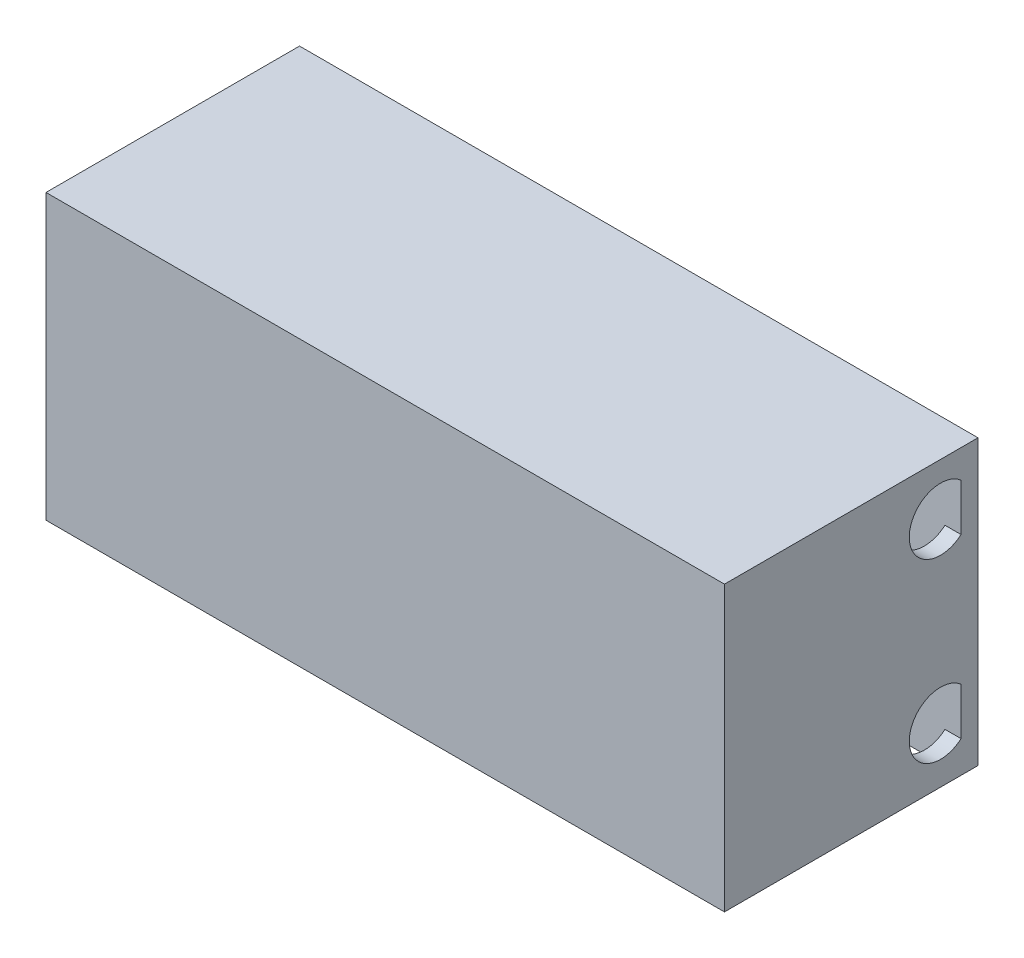
from build123d import *

# Parameters (mm, degrees)
SKETCH1_W            = 76
SKETCH1_H            = 28.4
BOSS_EXTRUDE1_DEPTH  = 1.8
SKETCH2_W            = 76
SKETCH2_H            = 1.8
BOSS_EXTRUDE2_DEPTH  = 30
SKETCH3_W            = 1.8
SKETCH3_H            = 26.6
BOSS_EXTRUDE3_DEPTH  = 30
SKETCH4_W            = 72.4
SKETCH4_H            = 1.2
BOSS_EXTRUDE4_DEPTH  = 1
SKETCH5_W            = 5
SKETCH5_H            = 1.2
BOSS_EXTRUDE5_DEPTH  = 28
SKETCH6_W            = 2.8
SKETCH6_H            = 10
CUT_EXTRUDE1_DEPTH   = 2
SKETCH7_W            = 5
SKETCH7_H            = 1.2
BOSS_EXTRUDE6_DEPTH  = 10
SKETCH8_W            = 8
SKETCH8_H            = 1.2
CUT_EXTRUDE2_DEPTH   = 0.7
SKETCH9_W            = 10
SKETCH9_H            = 0.1
BOSS_EXTRUDE7_DEPTH  = 30
CUT_EXTRUDE3_DEPTH   = 2
SKETCH11_W           = 62.4
SKETCH11_H           = 1.2
BOSS_EXTRUDE8_DEPTH  = 28
SKETCH12_W           = 72.4
SKETCH12_H           = 1.2
BOSS_EXTRUDE9_DEPTH  = 29
SKETCH13_W           = 72.4
SKETCH13_H           = 1.2
BOSS_EXTRUDE10_DEPTH = 1
SKETCH14_W           = 5
SKETCH14_H           = 1.2
SKETCH14_W_2         = 12
BOSS_EXTRUDE11_DEPTH = 5
SKETCH15_W           = 6
SKETCH15_H           = 5
BOSS_EXTRUDE12_DEPTH = 2
SKETCH16_W           = 2.4
SKETCH16_H           = 13.5
CUT_EXTRUDE4_DEPTH   = 2
SKETCH17_W           = 72.4
SKETCH17_H           = 1.8
BOSS_EXTRUDE13_DEPTH = 30
FILLET1_R            = 4
SKETCH19_W           = 2.3
SKETCH19_H           = 1.5
BOSS_EXTRUDE14_DEPTH = 29
FILLET2_R            = 4
FILLET3_R            = 4
FILLET4_R            = 4
SKETCH18_W           = 1
SKETCH18_H           = 10
CUT_EXTRUDE5_DEPTH   = 2


with BuildPart() as part:
    # Sketch1 → Boss-Extrude1 (new body)
    with BuildSketch(Plane(origin=(0, 0, 0), x_dir=(1, 0, 0), z_dir=(0, 1, 0))):
        with Locations((-38, 14.2)):
            Rectangle(SKETCH1_W, SKETCH1_H)
    extrude(amount=BOSS_EXTRUDE1_DEPTH)

    # Sketch2 → Boss-Extrude2 (add)
    with BuildSketch(Plane(origin=(0, 0, 0), x_dir=(-1, 0, 0), z_dir=(0, -1, 0))):
        with Locations((38, 27.5)):
            Rectangle(SKETCH2_W, SKETCH2_H)
    extrude(amount=BOSS_EXTRUDE2_DEPTH)

    # Sketch3 → Boss-Extrude3 (add)
    with BuildSketch(Plane(origin=(0, 0, 0), x_dir=(-1, 0, 0), z_dir=(0, -1, 0))):
        with Locations((75.1, 13.3)):
            Rectangle(SKETCH3_W, SKETCH3_H)
        with Locations((0.9, 13.3)):
            Rectangle(SKETCH3_W, SKETCH3_H)
    extrude(amount=BOSS_EXTRUDE3_DEPTH)

    # Sketch4 → Boss-Extrude4 (add)
    with BuildSketch(Plane(origin=(0, 0, 0), x_dir=(-1, 0, 0), z_dir=(0, -1, 0))):
        with Locations((38, 19.1)):
            Rectangle(SKETCH4_W, SKETCH4_H)
        with Locations((38, 22.1)):
            Rectangle(SKETCH4_W, SKETCH4_H)
    extrude(amount=BOSS_EXTRUDE4_DEPTH)

    # Sketch5 → Boss-Extrude5 (add)
    with BuildSketch(Plane(origin=(0, -1, 0), x_dir=(-1, 0, 0), z_dir=(0, -1, 0))):
        with Locations((4.3, 19.1)):
            Rectangle(SKETCH5_W, SKETCH5_H)
        with Locations((71.7, 19.1)):
            Rectangle(SKETCH5_W, SKETCH5_H)
    extrude(amount=BOSS_EXTRUDE5_DEPTH)

    # Sketch6 → Cut-Extrude1 (cut)
    with BuildSketch(Plane(origin=(-74.2, 0, 0), x_dir=(0, 0, -1), z_dir=(1, 0, 0))):
        with Locations((22.9, -6)):
            Rectangle(SKETCH6_W, SKETCH6_H)
    extrude(amount=-CUT_EXTRUDE1_DEPTH, mode=Mode.SUBTRACT)

    # Sketch7 → Boss-Extrude6 (add)
    with BuildSketch(Plane(origin=(0, 0, 0), x_dir=(-1, 0, 0), z_dir=(0, -1, 0))):
        with Locations((71.7, 24.9)):
            Rectangle(SKETCH7_W, SKETCH7_H)
    extrude(amount=BOSS_EXTRUDE6_DEPTH)

    # Sketch8 → Cut-Extrude2 (cut)
    with BuildSketch(Plane(origin=(0, -1, 0), x_dir=(-1, 0, 0), z_dir=(0, -1, 0))):
        with Locations((5.8, 22.1)):
            Rectangle(SKETCH8_W, SKETCH8_H)
    extrude(amount=-CUT_EXTRUDE2_DEPTH, mode=Mode.SUBTRACT)

    # Sketch9 → Boss-Extrude7 (add)
    with BuildSketch(Plane(origin=(0, 0, 0), x_dir=(-1, 0, 0), z_dir=(0, -1, 0))):
        with Locations((6.8, 26.55)):
            Rectangle(SKETCH9_W, SKETCH9_H)
    extrude(amount=BOSS_EXTRUDE7_DEPTH)

    # Sketch10 → Cut-Extrude3 (cut)
    with BuildSketch(Plane.ZY.offset(1.8)):
        with BuildLine():
            Line((-26.5, -6.638181192), (-26.5, -1.361818808))
            ThreePointArc((-26.5, -1.361818808), (-20.7, -4), (-26.5, -6.638181192))
        make_face()
        with BuildLine():
            Line((-26.5, -21.161818808), (-26.5, -26.438181192))
            ThreePointArc((-26.5, -26.438181192), (-20.7, -23.8), (-26.5, -21.161818808))
        make_face()
    extrude(amount=-CUT_EXTRUDE3_DEPTH, mode=Mode.SUBTRACT)

    # Sketch11 → Boss-Extrude8 (add)
    with BuildSketch(Plane(origin=(0, -1, 0), x_dir=(-1, 0, 0), z_dir=(0, -1, 0))):
        with Locations((38, 19.1)):
            Rectangle(SKETCH11_W, SKETCH11_H)
    extrude(amount=BOSS_EXTRUDE8_DEPTH)

    # Sketch12 → Boss-Extrude9 (add)
    with BuildSketch(Plane.XZ):
        with Locations((-38, -7.7)):
            Rectangle(SKETCH12_W, SKETCH12_H)
    extrude(amount=BOSS_EXTRUDE9_DEPTH)

    # Sketch13 → Boss-Extrude10 (add)
    with BuildSketch(Plane(origin=(0, 0, 0), x_dir=(-1, 0, 0), z_dir=(0, -1, 0))):
        with Locations((38, 4.5)):
            Rectangle(SKETCH13_W, SKETCH13_H)
    extrude(amount=BOSS_EXTRUDE10_DEPTH)

    # Sketch14 → Boss-Extrude11 (add)
    with BuildSketch(Plane(origin=(0, -1, 0), x_dir=(-1, 0, 0), z_dir=(0, -1, 0))):
        with Locations((71.7, 4.5)):
            Rectangle(SKETCH14_W, SKETCH14_H)
        with Locations((7.8, 4.5)):
            Rectangle(SKETCH14_W_2, SKETCH14_H)
    extrude(amount=BOSS_EXTRUDE11_DEPTH)

    # Sketch15 → Boss-Extrude12 (add)
    with BuildSketch(Plane.XY.offset(-7.1)):
        with Locations((-4.8, -26.5)):
            Rectangle(SKETCH15_W, SKETCH15_H)
        with Locations((-4.8, -2.5)):
            Rectangle(SKETCH15_W, SKETCH15_H)
    extrude(amount=BOSS_EXTRUDE12_DEPTH)

    # Sketch16 → Cut-Extrude4 (cut)
    with BuildSketch(Plane(origin=(-74.2, 0, 0), x_dir=(0, 0, -1), z_dir=(1, 0, 0))):
        with Locations((5.3, -13.25)):
            Rectangle(SKETCH16_W, SKETCH16_H)
    extrude(amount=-CUT_EXTRUDE4_DEPTH, mode=Mode.SUBTRACT)

    # Sketch17 → Boss-Extrude13 (add)
    with BuildSketch(Plane(origin=(0, 0, 0), x_dir=(-1, 0, 0), z_dir=(0, -1, 0))):
        with Locations((38, 0.9)):
            Rectangle(SKETCH17_W, SKETCH17_H)
    extrude(amount=BOSS_EXTRUDE13_DEPTH)

    # Fillet1
    # the kernel refuses this fillet: 4 mm, written as the material it adds along each edge
    with BuildSketch(Plane(origin=(-74.2, 0, -25.5), x_dir=(0, -1, 0), z_dir=(1, 0, 0))) as fillet1_piece_1:
        with BuildLine():
            CenterArc((2.754995463, 4), FILLET1_R, 226.468847833, 43.531152167)
            Line((0, 1.1), (-0.055099909, 1.042))
            ThreePointArc((-0.055099909, 1.042), (-0.08, 0.55), (-0.08, 0))
            Line((-0.08, 0), (0, -0.08))
            Line((0, -0.08), (2.754995463, -0.08))
            Line((2.754995463, -0.08), (2.754995463, 0))
        make_face()
    extrude(amount=5)
    with BuildSketch(Plane(origin=(-74.2, 0, -25.5), x_dir=(0, 0, -1), z_dir=(0, -1, 0))) as fillet1_piece_2:
        with BuildLine():
            CenterArc((4, 2.754995463), FILLET1_R, 180, 43.531152167)
            Line((0, 2.754995463), (-0.08, 2.754995463))
            Line((-0.08, 2.754995463), (-0.08, 0))
            Line((-0.08, 0), (0, -0.08))
            ThreePointArc((0, -0.08), (0.55, -0.08), (1.042, -0.055099909))
            Line((1.042, -0.055099909), (1.1, 0))
        make_face()
    extrude(amount=10)
    with BuildSketch(Plane(origin=(-1.8, 0, -8.3), x_dir=(0, 0, -1), z_dir=(0, -1, 0))) as fillet1_piece_3:
        with BuildLine():
            CenterArc((FILLET1_R, -FILLET1_R), FILLET1_R, 90, 90)
            Line((0, -FILLET1_R), (-FILLET1_R * 0.02, -FILLET1_R))
            Line((-FILLET1_R * 0.02, -FILLET1_R), (-FILLET1_R * 0.02, FILLET1_R * 0.02))
            Line((-FILLET1_R * 0.02, FILLET1_R * 0.02), (FILLET1_R, FILLET1_R * 0.02))
            Line((FILLET1_R, FILLET1_R * 0.02), (FILLET1_R, 0))
        make_face()
    extrude(amount=29)
    with BuildSketch(Plane(origin=(-1.8, 0, -8.3), x_dir=(0, 0, -1), z_dir=(-1, 0, 0)), Plane(origin=(-1.8, 0, -18.5), x_dir=(0, -1, 0), z_dir=(-1, 0, 0))) as fillet1_piece_4:
        with BuildLine():
            CenterArc((FILLET1_R, FILLET1_R), FILLET1_R, 180, 90)
            Line((0, FILLET1_R), (-FILLET1_R * 0.02, FILLET1_R))
            Line((-FILLET1_R * 0.02, FILLET1_R), (-FILLET1_R * 0.02, -FILLET1_R * 0.02))
            Line((-FILLET1_R * 0.02, -FILLET1_R * 0.02), (FILLET1_R, -FILLET1_R * 0.02))
            Line((FILLET1_R, -FILLET1_R * 0.02), (FILLET1_R, 0))
        make_face()
    extrude(amount=72.4)
    with BuildSketch(Plane(origin=(-74.2, 0, -8.3), x_dir=(0, 0, -1), z_dir=(0, -1, 0)), Plane(origin=(-1.8, 0, -18.5), x_dir=(0, 0, 1), z_dir=(0, -1, 0)), Plane(origin=(-74.2, -29, -18.5), x_dir=(0, 0, 1), z_dir=(0, 1, 0))) as fillet1_piece_5:
        with BuildLine():
            CenterArc((FILLET1_R, FILLET1_R), FILLET1_R, 180, 90)
            Line((0, FILLET1_R), (-FILLET1_R * 0.02, FILLET1_R))
            Line((-FILLET1_R * 0.02, FILLET1_R), (-FILLET1_R * 0.02, -FILLET1_R * 0.02))
            Line((-FILLET1_R * 0.02, -FILLET1_R * 0.02), (FILLET1_R, -FILLET1_R * 0.02))
            Line((FILLET1_R, -FILLET1_R * 0.02), (FILLET1_R, 0))
        make_face()
    extrude(amount=29)
    with BuildSketch(Plane(origin=(-74.2, 6.887488657, -25.5), x_dir=(0, 0, -1), z_dir=(0, -1, 0))) as fillet1_piece_6a_section:
        with BuildLine():
            CenterArc((4, 2.754995463), FILLET1_R, 180, 43.531152167)
            Line((0, 2.754995463), (-0.08, 2.754995463))
            Line((-0.08, 2.754995463), (-0.08, 0))
            Line((-0.08, 0), (0, -0.08))
            ThreePointArc((0, -0.08), (0.55, -0.08), (1.042, -0.055099909))
            Line((1.042, -0.055099909), (1.1, 0))
        make_face()
    fillet1_piece_6a = extrude(amount=16.887488657, mode=Mode.PRIVATE)
    fillet1_piece_6a = split(fillet1_piece_6a, bisect_by=Plane(origin=(-73.454361025, 0, -25.767986637), z_dir=(0, 1, 0)), keep=Keep.TOP, mode=Mode.PRIVATE)
    with BuildSketch(Plane(origin=(-81.087488657, 0, -25.5), x_dir=(0, -1, 0), z_dir=(1, 0, 0))) as fillet1_piece_6b_section:
        with BuildLine():
            CenterArc((2.754995463, 4), FILLET1_R, 226.468847833, 43.531152167)
            Line((0, 1.1), (-0.055099909, 1.042))
            ThreePointArc((-0.055099909, 1.042), (-0.08, 0.55), (-0.08, 0))
            Line((-0.08, 0), (0, -0.08))
            Line((0, -0.08), (2.754995463, -0.08))
            Line((2.754995463, -0.08), (2.754995463, 0))
        make_face()
    fillet1_piece_6b = extrude(amount=11.887488657, mode=Mode.PRIVATE)
    fillet1_piece_6b = split(fillet1_piece_6b, bisect_by=Plane(origin=(-74.2, -0.745638975, -25.767986637), z_dir=(-1, 0, 0)), keep=Keep.TOP, mode=Mode.PRIVATE)
    fillet1_piece_6 = fillet1_piece_6a & fillet1_piece_6b
    add(fillet1_piece_6)
    with BuildSketch(Plane(origin=(-1.8, 10, -8.3), x_dir=(0, 0, -1), z_dir=(0, -1, 0))) as fillet1_piece_7a_section:
        with BuildLine():
            CenterArc((FILLET1_R, -FILLET1_R), FILLET1_R, 90, 90)
            Line((0, -FILLET1_R), (-FILLET1_R * 0.02, -FILLET1_R))
            Line((-FILLET1_R * 0.02, -FILLET1_R), (-FILLET1_R * 0.02, FILLET1_R * 0.02))
            Line((-FILLET1_R * 0.02, FILLET1_R * 0.02), (FILLET1_R, FILLET1_R * 0.02))
            Line((FILLET1_R, FILLET1_R * 0.02), (FILLET1_R, 0))
        make_face()
    fillet1_piece_7a = extrude(amount=39, mode=Mode.PRIVATE)
    fillet1_piece_7a = split(fillet1_piece_7a, bisect_by=Plane(origin=(-2.705580457, 0, -9.205580457), z_dir=(0, 1, 0)), keep=Keep.TOP, mode=Mode.PRIVATE)
    with BuildSketch(Plane(origin=(8.2, 0, -8.3), x_dir=(0, 0, -1), z_dir=(-1, 0, 0))) as fillet1_piece_7b_section:
        with BuildLine():
            CenterArc((FILLET1_R, FILLET1_R), FILLET1_R, 180, 90)
            Line((0, FILLET1_R), (-FILLET1_R * 0.02, FILLET1_R))
            Line((-FILLET1_R * 0.02, FILLET1_R), (-FILLET1_R * 0.02, -FILLET1_R * 0.02))
            Line((-FILLET1_R * 0.02, -FILLET1_R * 0.02), (FILLET1_R, -FILLET1_R * 0.02))
            Line((FILLET1_R, -FILLET1_R * 0.02), (FILLET1_R, 0))
        make_face()
    fillet1_piece_7b = extrude(amount=82.4, mode=Mode.PRIVATE)
    fillet1_piece_7b = split(fillet1_piece_7b, bisect_by=Plane(origin=(-1.8, -0.905580457, -9.205580457), z_dir=(1, 0, 0)), keep=Keep.TOP, mode=Mode.PRIVATE)
    fillet1_piece_7 = fillet1_piece_7a & fillet1_piece_7b
    add(fillet1_piece_7)
    with BuildSketch(Plane(origin=(-74.2, 10, -8.3), x_dir=(0, 0, -1), z_dir=(0, -1, 0))) as fillet1_piece_8a_section:
        with BuildLine():
            CenterArc((FILLET1_R, FILLET1_R), FILLET1_R, 180, 90)
            Line((0, FILLET1_R), (-FILLET1_R * 0.02, FILLET1_R))
            Line((-FILLET1_R * 0.02, FILLET1_R), (-FILLET1_R * 0.02, -FILLET1_R * 0.02))
            Line((-FILLET1_R * 0.02, -FILLET1_R * 0.02), (FILLET1_R, -FILLET1_R * 0.02))
            Line((FILLET1_R, -FILLET1_R * 0.02), (FILLET1_R, 0))
        make_face()
    fillet1_piece_8a = extrude(amount=39, mode=Mode.PRIVATE)
    fillet1_piece_8a = split(fillet1_piece_8a, bisect_by=Plane(origin=(-73.294419543, 0, -9.205580457), z_dir=(0, 1, 0)), keep=Keep.TOP, mode=Mode.PRIVATE)
    with BuildSketch(Plane(origin=(-1.8, 0, -8.3), x_dir=(0, 0, -1), z_dir=(-1, 0, 0))) as fillet1_piece_8b_section:
        with BuildLine():
            CenterArc((FILLET1_R, FILLET1_R), FILLET1_R, 180, 90)
            Line((0, FILLET1_R), (-FILLET1_R * 0.02, FILLET1_R))
            Line((-FILLET1_R * 0.02, FILLET1_R), (-FILLET1_R * 0.02, -FILLET1_R * 0.02))
            Line((-FILLET1_R * 0.02, -FILLET1_R * 0.02), (FILLET1_R, -FILLET1_R * 0.02))
            Line((FILLET1_R, -FILLET1_R * 0.02), (FILLET1_R, 0))
        make_face()
    fillet1_piece_8b = extrude(amount=82.4, mode=Mode.PRIVATE)
    fillet1_piece_8b = split(fillet1_piece_8b, bisect_by=Plane(origin=(-74.2, -0.905580457, -9.205580457), z_dir=(-1, 0, 0)), keep=Keep.TOP, mode=Mode.PRIVATE)
    fillet1_piece_8 = fillet1_piece_8a & fillet1_piece_8b
    add(fillet1_piece_8)
    with BuildSketch(Plane(origin=(-1.8, 10, -18.5), x_dir=(0, 0, 1), z_dir=(0, -1, 0))) as fillet1_piece_9a_section:
        with BuildLine():
            CenterArc((FILLET1_R, FILLET1_R), FILLET1_R, 180, 90)
            Line((0, FILLET1_R), (-FILLET1_R * 0.02, FILLET1_R))
            Line((-FILLET1_R * 0.02, FILLET1_R), (-FILLET1_R * 0.02, -FILLET1_R * 0.02))
            Line((-FILLET1_R * 0.02, -FILLET1_R * 0.02), (FILLET1_R, -FILLET1_R * 0.02))
            Line((FILLET1_R, -FILLET1_R * 0.02), (FILLET1_R, 0))
        make_face()
    fillet1_piece_9a = extrude(amount=39, mode=Mode.PRIVATE)
    fillet1_piece_9a = split(fillet1_piece_9a, bisect_by=Plane(origin=(-2.705580457, 0, -17.594419543), z_dir=(0, 1, 0)), keep=Keep.TOP, mode=Mode.PRIVATE)
    with BuildSketch(Plane(origin=(8.2, 0, -18.5), x_dir=(0, -1, 0), z_dir=(-1, 0, 0))) as fillet1_piece_9b_section:
        with BuildLine():
            CenterArc((FILLET1_R, FILLET1_R), FILLET1_R, 180, 90)
            Line((0, FILLET1_R), (-FILLET1_R * 0.02, FILLET1_R))
            Line((-FILLET1_R * 0.02, FILLET1_R), (-FILLET1_R * 0.02, -FILLET1_R * 0.02))
            Line((-FILLET1_R * 0.02, -FILLET1_R * 0.02), (FILLET1_R, -FILLET1_R * 0.02))
            Line((FILLET1_R, -FILLET1_R * 0.02), (FILLET1_R, 0))
        make_face()
    fillet1_piece_9b = extrude(amount=82.4, mode=Mode.PRIVATE)
    fillet1_piece_9b = split(fillet1_piece_9b, bisect_by=Plane(origin=(-1.8, -0.905580457, -17.594419543), z_dir=(1, 0, 0)), keep=Keep.TOP, mode=Mode.PRIVATE)
    fillet1_piece_9 = fillet1_piece_9a & fillet1_piece_9b
    add(fillet1_piece_9)
    with BuildSketch(Plane(origin=(-74.2, -29, -18.5), x_dir=(0, 0, 1), z_dir=(0, 1, 0))) as fillet1_piece_10a_section:
        with BuildLine():
            CenterArc((FILLET1_R, FILLET1_R), FILLET1_R, 180, 90)
            Line((0, FILLET1_R), (-FILLET1_R * 0.02, FILLET1_R))
            Line((-FILLET1_R * 0.02, FILLET1_R), (-FILLET1_R * 0.02, -FILLET1_R * 0.02))
            Line((-FILLET1_R * 0.02, -FILLET1_R * 0.02), (FILLET1_R, -FILLET1_R * 0.02))
            Line((FILLET1_R, -FILLET1_R * 0.02), (FILLET1_R, 0))
        make_face()
    fillet1_piece_10a = extrude(amount=39, mode=Mode.PRIVATE)
    fillet1_piece_10a = split(fillet1_piece_10a, bisect_by=Plane(origin=(-73.294419543, 0, -17.594419543), z_dir=(0, 1, 0)), keep=Keep.TOP, mode=Mode.PRIVATE)
    with BuildSketch(Plane(origin=(-1.8, 0, -18.5), x_dir=(0, -1, 0), z_dir=(-1, 0, 0))) as fillet1_piece_10b_section:
        with BuildLine():
            CenterArc((FILLET1_R, FILLET1_R), FILLET1_R, 180, 90)
            Line((0, FILLET1_R), (-FILLET1_R * 0.02, FILLET1_R))
            Line((-FILLET1_R * 0.02, FILLET1_R), (-FILLET1_R * 0.02, -FILLET1_R * 0.02))
            Line((-FILLET1_R * 0.02, -FILLET1_R * 0.02), (FILLET1_R, -FILLET1_R * 0.02))
            Line((FILLET1_R, -FILLET1_R * 0.02), (FILLET1_R, 0))
        make_face()
    fillet1_piece_10b = extrude(amount=82.4, mode=Mode.PRIVATE)
    fillet1_piece_10b = split(fillet1_piece_10b, bisect_by=Plane(origin=(-74.2, -0.905580457, -17.594419543), z_dir=(-1, 0, 0)), keep=Keep.TOP, mode=Mode.PRIVATE)
    fillet1_piece_10 = fillet1_piece_10a & fillet1_piece_10b
    add(fillet1_piece_10)

    # Sketch19 → Boss-Extrude14 (add)
    with BuildSketch(Plane(origin=(0, 0, 0), x_dir=(-1, 0, 0), z_dir=(0, -1, 0))):
        with Locations((2.95, 20.45)):
            Rectangle(SKETCH19_W, SKETCH19_H)
    extrude(amount=BOSS_EXTRUDE14_DEPTH)

    # Fillet2
    # the kernel refuses this fillet: 4 mm, written as the material it adds along each edge
    with BuildSketch(Plane(origin=(-74.2, 0, -3.9), x_dir=(0, 0, 1), z_dir=(1, 0, 0))) as fillet2_piece_1_section:
        with BuildLine():
            CenterArc((4, 3.519943181), FILLET2_R, 180, 61.640649972)
            Line((0, 3.519943181), (-0.08, 3.519943181))
            Line((-0.08, 3.519943181), (-0.08, 0))
            Line((-0.08, 0), (0, -0.08))
            ThreePointArc((0, -0.08), (1.05, -0.08), (2.062, -0.070398864))
            Line((2.062, -0.070398864), (2.1, 0))
        make_face()
    fillet2_piece_1 = extrude(amount=72.4, mode=Mode.PRIVATE)
    fillet2_piece_1 = split(fillet2_piece_1, bisect_by=Plane(origin=(-69.2, -0.386743346, -3.163583033), z_dir=(-1, 0, 0)), keep=Keep.TOP, mode=Mode.PRIVATE)
    fillet2_piece_1 = split(fillet2_piece_1, bisect_by=Plane(origin=(-71.7, -1, -3.163583033), z_dir=(0, 1, 0)), keep=Keep.TOP, mode=Mode.PRIVATE)
    add(fillet2_piece_1)
    with BuildSketch(Plane(origin=(-74.2, 0, -3.9), x_dir=(0, 0, 1), z_dir=(1, 0, 0))) as fillet2_piece_2_section:
        with BuildLine():
            CenterArc((4, 3.519943181), FILLET2_R, 180, 61.640649972)
            Line((0, 3.519943181), (-0.08, 3.519943181))
            Line((-0.08, 3.519943181), (-0.08, 0))
            Line((-0.08, 0), (0, -0.08))
            ThreePointArc((0, -0.08), (1.05, -0.08), (2.062, -0.070398864))
            Line((2.062, -0.070398864), (2.1, 0))
        make_face()
    fillet2_piece_2 = extrude(amount=72.4, mode=Mode.PRIVATE)
    fillet2_piece_2 = split(fillet2_piece_2, bisect_by=Plane(origin=(-69.2, -1.757123938, -3.704514418), z_dir=(-1, 0, 0)), keep=Keep.TOP, mode=Mode.PRIVATE)
    fillet2_piece_2 = split(fillet2_piece_2, bisect_by=Plane(origin=(-71.7, -1, -3.704514418), z_dir=(0, -1, 0)), keep=Keep.TOP, mode=Mode.PRIVATE)
    add(fillet2_piece_2)
    with BuildSketch(Plane(origin=(-74.2, 0, -3.9), x_dir=(0, 0, 1), z_dir=(1, 0, 0))) as fillet2_piece_3_section:
        with BuildLine():
            CenterArc((4, 3.519943181), FILLET2_R, 180, 61.640649972)
            Line((0, 3.519943181), (-0.08, 3.519943181))
            Line((-0.08, 3.519943181), (-0.08, 0))
            Line((-0.08, 0), (0, -0.08))
            ThreePointArc((0, -0.08), (1.05, -0.08), (2.062, -0.070398864))
            Line((2.062, -0.070398864), (2.1, 0))
        make_face()
    fillet2_piece_3 = extrude(amount=72.4, mode=Mode.PRIVATE)
    fillet2_piece_3 = split(fillet2_piece_3, bisect_by=Plane(origin=(-69.2, -0.386743346, -3.163583033), z_dir=(1, 0, 0)), keep=Keep.TOP, mode=Mode.PRIVATE)
    fillet2_piece_3 = split(fillet2_piece_3, bisect_by=Plane(origin=(-41.5, -1, -3.163583033), z_dir=(0, 1, 0)), keep=Keep.TOP, mode=Mode.PRIVATE)
    fillet2_piece_3 = split(fillet2_piece_3, bisect_by=Plane(origin=(-13.8, -0.386743346, -3.163583033), z_dir=(-1, 0, 0)), keep=Keep.TOP, mode=Mode.PRIVATE)
    add(fillet2_piece_3)
    with BuildSketch(Plane(origin=(-74.2, 0, -3.9), x_dir=(0, 0, 1), z_dir=(1, 0, 0))) as fillet2_piece_4_section:
        with BuildLine():
            CenterArc((4, 3.519943181), FILLET2_R, 180, 61.640649972)
            Line((0, 3.519943181), (-0.08, 3.519943181))
            Line((-0.08, 3.519943181), (-0.08, 0))
            Line((-0.08, 0), (0, -0.08))
            ThreePointArc((0, -0.08), (1.05, -0.08), (2.062, -0.070398864))
            Line((2.062, -0.070398864), (2.1, 0))
        make_face()
    fillet2_piece_4 = extrude(amount=72.4, mode=Mode.PRIVATE)
    fillet2_piece_4 = split(fillet2_piece_4, bisect_by=Plane(origin=(-7.8, -1, -3.163583033), z_dir=(0, 1, 0)), keep=Keep.TOP, mode=Mode.PRIVATE)
    fillet2_piece_4 = split(fillet2_piece_4, bisect_by=Plane(origin=(-13.8, -0.386743346, -3.163583033), z_dir=(1, 0, 0)), keep=Keep.TOP, mode=Mode.PRIVATE)
    add(fillet2_piece_4)
    with BuildSketch(Plane(origin=(-74.2, 0, -3.9), x_dir=(0, 0, 1), z_dir=(1, 0, 0))) as fillet2_piece_5_section:
        with BuildLine():
            CenterArc((4, 3.519943181), FILLET2_R, 180, 61.640649972)
            Line((0, 3.519943181), (-0.08, 3.519943181))
            Line((-0.08, 3.519943181), (-0.08, 0))
            Line((-0.08, 0), (0, -0.08))
            ThreePointArc((0, -0.08), (1.05, -0.08), (2.062, -0.070398864))
            Line((2.062, -0.070398864), (2.1, 0))
        make_face()
    fillet2_piece_5 = extrude(amount=72.4, mode=Mode.PRIVATE)
    fillet2_piece_5 = split(fillet2_piece_5, bisect_by=Plane(origin=(-7.8, -1, -3.704514418), z_dir=(0, -1, 0)), keep=Keep.TOP, mode=Mode.PRIVATE)
    fillet2_piece_5 = split(fillet2_piece_5, bisect_by=Plane(origin=(-13.8, -1.757123938, -3.704514418), z_dir=(1, 0, 0)), keep=Keep.TOP, mode=Mode.PRIVATE)
    add(fillet2_piece_5)

    # Fillet3
    # the kernel refuses this fillet: 4 mm, written as the material it adds along each edge
    with BuildSketch(Plane(origin=(-74.2, -6, -3.9), x_dir=(1, 0, 0), z_dir=(0, 1, 0))) as fillet3_piece_1_section:
        with BuildLine():
            CenterArc((FILLET3_R, -FILLET3_R), FILLET3_R, 90, 90)
            Line((0, -FILLET3_R), (0, 0))
            Line((0, 0), (FILLET3_R, 0))
        make_face()
    fillet3_piece_1 = extrude(amount=2.480056819, mode=Mode.PRIVATE)
    fillet3_piece_1 = split(fillet3_piece_1, bisect_by=Plane(origin=(-72.77704302, -5.337014611, -1.8), z_dir=(0, 0, -1)), keep=Keep.TOP, mode=Mode.PRIVATE)
    add(fillet3_piece_1)
    with BuildSketch(Plane(origin=(-74.2, -3.519943181, 0.1), x_dir=(0, -0.42114798724942737, 0.9069919364778037), z_dir=(0, -0.9069919364778037, -0.42114798724942737))) as fillet3_piece_2_section:
        with BuildLine():
            CenterArc((4 - FILLET3_R, -FILLET3_R), FILLET3_R, 0, 90)
            Line((4 - FILLET3_R, 0), (4, 0))
            Line((4, 0), (4, -FILLET3_R))
        make_face()
    fillet3_piece_2 = revolve(axis=Axis((-74.2, -3.519943181, 0.1), (-1, 0, 0)), revolution_arc=204.907085957, mode=Mode.PRIVATE)
    fillet3_piece_2 = split(fillet3_piece_2, bisect_by=Plane(origin=(-73.105752366, -1.96496167, -1.8), z_dir=(0, 0, -1)), keep=Keep.TOP, mode=Mode.PRIVATE)
    add(fillet3_piece_2)

    # Fillet4
    # the kernel refuses this fillet: 4 mm, written as the material it adds along each edge
    with BuildSketch(Plane(origin=(-1.8, -3.519943181, -3.9), x_dir=(0, 0, 1), z_dir=(0, -1, 0))) as fillet4_piece_1_section:
        with BuildLine():
            CenterArc((FILLET4_R, FILLET4_R), FILLET4_R, 180, 90)
            Line((0, FILLET4_R), (0, 0))
            Line((0, 0), (FILLET4_R, 0))
        make_face()
    fillet4_piece_1 = extrude(amount=2.480056819, mode=Mode.PRIVATE)
    fillet4_piece_1 = split(fillet4_piece_1, bisect_by=Plane(origin=(-2.621035263, -4.579536444, 0), z_dir=(0, 0, -1)), keep=Keep.TOP, mode=Mode.PRIVATE)
    add(fillet4_piece_1)
    with BuildSketch(Plane(origin=(-1.8, -3.519943181, 0.1), x_dir=(0, 0, -1), z_dir=(0, -1, 0))) as fillet4_piece_2_section:
        with BuildLine():
            CenterArc((4 - FILLET4_R, -FILLET4_R), FILLET4_R, 0, 90)
            Line((4 - FILLET4_R, 0), (4, 0))
            Line((4, 0), (4, -FILLET4_R))
        make_face()
    fillet4_piece_2 = revolve(axis=Axis((-1.8, -3.519943181, 0.1), (1, 0, 0)), revolution_arc=204.907085957, mode=Mode.PRIVATE)
    fillet4_piece_2 = split(fillet4_piece_2, bisect_by=Plane(origin=(-2.894247633, -1.96496167, 0), z_dir=(0, 0, -1)), keep=Keep.TOP, mode=Mode.PRIVATE)
    add(fillet4_piece_2)

    # Sketch18 → Cut-Extrude5 (cut)
    with BuildSketch(Plane(origin=(-74.2, 0, 0), x_dir=(0, 0, -1), z_dir=(1, 0, 0))):
        with Locations((21, -6)):
            Rectangle(SKETCH18_W, SKETCH18_H)
    extrude(amount=-CUT_EXTRUDE5_DEPTH, mode=Mode.SUBTRACT)


solid = part.part
